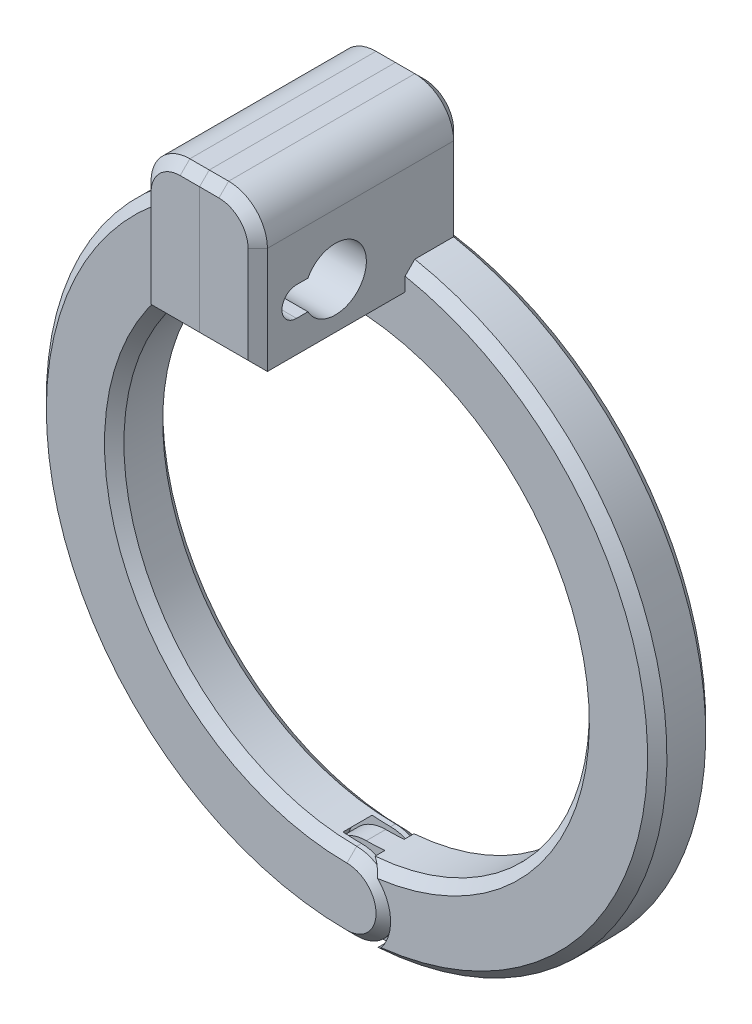
from build123d import *

# Parameters (mm, degrees)
AUFSATZ_LINEAR_AUSTRAGEN1_DEPTH             = 3
SKIZZE2_R                                   = 4.5
SCHNITT_LINEAR_AUSTRAGEN1_DEPTH             = 1.5
AUFSATZ_LINEAR_AUSTRAGEN2_REACH             = 73.617
SKIZZE3_R                                   = 2
AUFSATZ_LINEAR_AUSTRAGEN2_DIRECTION_2_REACH = 73.617
SKIZZE4_R                                   = 2.5
AUFSATZ_LINEAR_AUSTRAGEN4_DEPTH             = 3
SKIZZE5_R                                   = 4.5
SCHNITT_LINEAR_AUSTRAGEN2_DEPTH             = 2
AUFSATZ_LINEAR_START                        = -6
AUFSATZ_LINEAR_AUSTRAGEN5_DEPTH             = 6
AUFSATZ_LINEAR_AUSTRAGEN6_DEPTH             = 6
AUFSATZ_LINEAR_AUSTRAGEN7_DEPTH             = 15.2
AUFSATZ_LINEAR_START_2                      = 15.2
AUFSATZ_LINEAR_AUSTRAGEN9_DEPTH             = 15.2
SCHNITT_LINEAR_AUSTRAGEN3_DEPTH             = 6.5
FASE1_SIZE                                  = 1
FASE2_SIZE                                  = 1
FASE3_SIZE                                  = 1
FASE4_SIZE                                  = 1
FASE5_SIZE                                  = 1
FASE6_SIZE                                  = 1


# Some blends are built 0.0001 mm under size
with BuildPart() as part:
    # Skizze1 → Aufsatz-Linear austragen1 (new, symmetric)
    with BuildSketch(Plane.XY):
        with BuildLine():
            Line((0, -8), (0, 0))
            ThreePointArc((0, 0), (-32, -32), (0, -64))
            ThreePointArc((0, -64), (4, -60), (0, -56))
            ThreePointArc((0, -56), (-24, -32), (0, -8))
        make_face()
    extrude(amount=AUFSATZ_LINEAR_AUSTRAGEN1_DEPTH, both=True)

    # Skizze2 → Schnitt-Linear austragen1 (cut, symmetric)
    with BuildSketch(Plane.XY):
        with Locations((0, -60)):
            Circle(SKIZZE2_R)
    extrude(amount=SCHNITT_LINEAR_AUSTRAGEN1_DEPTH, both=True, mode=Mode.SUBTRACT)

    # Aufsatz-Linear austragen2: up to this face of the body (flat: up to its plane)
    aufsatz_linear_austragen2_end = Plane(part.part.faces().sort_by_distance((-0.306004635, -59.992467517, 1.5))[0])
    # Skizze3 → Aufsatz-Linear austragen2 (add, up to the picked face)
    with BuildSketch(Plane.XY, mode=Mode.PRIVATE) as aufsatz_linear_austragen2_sk1:
        with Locations((0, -60)):
            Circle(SKIZZE3_R)
    aufsatz_linear_austragen2_tool1 = split(extrude(aufsatz_linear_austragen2_sk1.sketch, amount=AUFSATZ_LINEAR_AUSTRAGEN2_REACH, mode=Mode.PRIVATE), bisect_by=aufsatz_linear_austragen2_end, keep=Keep.BOTH, mode=Mode.PRIVATE)
    add(aufsatz_linear_austragen2_tool1.solids().sort_by(Axis((0, -60, 0), (0, 0, 1)))[0])

    # Aufsatz-Linear austragen2 direction 2: up to this face of the body (flat: up to its plane)
    aufsatz_linear_austragen2_direction_2_end = Plane(part.part.faces().sort_by_distance((-0.306004635, -59.992467517, -1.5))[0])
    # Skizze3 → Aufsatz-Linear austragen2 direction 2 (add, up to the picked face)
    with BuildSketch(Plane.XY, mode=Mode.PRIVATE) as aufsatz_linear_austragen2_direction_2_sk1:
        with Locations((0, -60)):
            Circle(SKIZZE3_R)
    aufsatz_linear_austragen2_direction_2_tool1 = split(extrude(aufsatz_linear_austragen2_direction_2_sk1.sketch, amount=-AUFSATZ_LINEAR_AUSTRAGEN2_DIRECTION_2_REACH, mode=Mode.PRIVATE), bisect_by=aufsatz_linear_austragen2_direction_2_end, keep=Keep.BOTH, mode=Mode.PRIVATE)
    add(aufsatz_linear_austragen2_direction_2_tool1.solids().sort_by(Axis((0, -60, 0), (0, 0, -1)))[0])

    # Skizze7 → Aufsatz-Linear austragen6 (add)
    with BuildSketch(Plane(origin=(0, 0, -3), x_dir=(-1, 0, 0), z_dir=(0, 0, -1)).offset(AUFSATZ_LINEAR_START)):
        with BuildLine():
            Line((0, 0), (0, 12))
            Line((0, 12), (2, 12))
            ThreePointArc((2, 12), (4.828427125, 10.828427125), (6, 8))
            Line((6, 8), (6, -0.567532709))
            ThreePointArc((6, -0.567532709), (3.013390672, -0.142199124), (0, 0))
        make_face()
    extrude(amount=AUFSATZ_LINEAR_AUSTRAGEN6_DEPTH)

    # Skizze9 → Aufsatz-Linear austragen9 (add)
    with BuildSketch(Plane.XY.offset(3).offset(AUFSATZ_LINEAR_START_2)):
        with BuildLine():
            Line((-6, -3), (0, -3))
            Line((0, -3), (0, 12))
            Line((0, 12), (-2, 12))
            ThreePointArc((-2, 12), (-4.828427125, 10.828427125), (-6, 8))
            Line((-6, 8), (-6, -0.567532709))
            Line((-6, -0.567532709), (-6, -3))
        make_face()
    extrude(amount=-AUFSATZ_LINEAR_AUSTRAGEN9_DEPTH)


with BuildPart() as body_2:
    # Skizze4 → Aufsatz-Linear austragen4 (new, symmetric)
    with BuildSketch(Plane.XY):
        with BuildLine():
            Line((0, -8), (0, 0))
            ThreePointArc((0, 0), (32, -32), (0, -64))
            ThreePointArc((0, -64), (-4, -60), (0, -56))
            ThreePointArc((0, -56), (24, -32), (0, -8))
        make_face()
        with Locations((0, -60)):
            Circle(SKIZZE4_R, mode=Mode.SUBTRACT)
    extrude(amount=AUFSATZ_LINEAR_AUSTRAGEN4_DEPTH, both=True)

    # Skizze5 → Schnitt-Linear austragen2 (cut)
    with BuildSketch(Plane.XY.offset(3)):
        with Locations((0, -60)):
            Circle(SKIZZE5_R)
    schnitt_linear_austragen2 = extrude(amount=-SCHNITT_LINEAR_AUSTRAGEN2_DEPTH, mode=Mode.SUBTRACT)

    # Spiegeln1: Schnitt-Linear austragen2 across plane
    add(schnitt_linear_austragen2.mirror(Plane.XY), mode=Mode.SUBTRACT)

    # Skizze6 → Aufsatz-Linear austragen5 (add)
    with BuildSketch(Plane(origin=(0, 0, -3), x_dir=(-1, 0, 0), z_dir=(0, 0, -1)).offset(AUFSATZ_LINEAR_START)):
        with BuildLine():
            Line((0, 0), (0, 12))
            Line((0, 12), (-2, 12))
            ThreePointArc((-2, 12), (-4.828427125, 10.828427125), (-6, 8))
            Line((-6, 8), (-6, -0.567532709))
            ThreePointArc((-6, -0.567532709), (-3.013390672, -0.142199124), (0, 0))
        make_face()
    extrude(amount=AUFSATZ_LINEAR_AUSTRAGEN5_DEPTH)

    # Skizze8 → Aufsatz-Linear austragen7 (add)
    with BuildSketch(Plane.XY.offset(3)):
        with BuildLine():
            Line((0, -3), (6, -3))
            Line((6, -3), (6, 8))
            ThreePointArc((6, 8), (4.828427125, 10.828427125), (2, 12))
            Line((2, 12), (0, 12))
            Line((0, 12), (0, -3))
        make_face()
    extrude(amount=AUFSATZ_LINEAR_AUSTRAGEN7_DEPTH)


with BuildPart() as schnitt_linear_austragen3_tool:
    # Skizze10 → Schnitt-Linear austragen3 (new, symmetric)
    with BuildSketch(Plane(origin=(0, 0, 0), x_dir=(0, 0, -1), z_dir=(1, 0, 0))):
        with BuildLine():
            Line((-14.2, 0.25), (-13.026658805, 0.25))
            ThreePointArc((-13.026658805, 0.25), (-7, 1.75), (-13.026658805, 3.25))
            Line((-13.026658805, 3.25), (-14.2, 3.25))
            ThreePointArc((-14.2, 3.25), (-15.7, 1.75), (-14.2, 0.25))
        make_face()
    extrude(amount=SCHNITT_LINEAR_AUSTRAGEN3_DEPTH, both=True)


with BuildPart() as part_1:
    add(part.part)

    # Schnitt-Linear austragen3: cut by schnitt_linear_austragen3_tool
    add(schnitt_linear_austragen3_tool.part, mode=Mode.SUBTRACT)

    # Fase2
    # the kernel refuses this chamfer: 1 mm, written as the material it takes off along each edge
    with BuildSketch(Plane(origin=(0, -32, 3), x_dir=(0.10711985504033346, -0.9942461147302201, 0), z_dir=(0.9942461147302201, 0.10711985504033346, 0))) as fase2_piece_1:
        Polygon((24, FASE2_SIZE), (24 + FASE2_SIZE, 0), (24, 0), align=None)
    revolve(axis=Axis((0, -32, 3), (0, 0, -1)), revolution_arc=192.298628552, mode=Mode.SUBTRACT)
    with BuildSketch(Plane(origin=(0, -32, -3), x_dir=(0.10711985504033346, -0.9942461147302201, 0), z_dir=(0.9942461147302201, 0.10711985504033346, 0))) as fase2_piece_2:
        Polygon((24, -FASE2_SIZE), (24 + FASE2_SIZE, 0), (24, 0), align=None)
    revolve(axis=Axis((0, -32, -3), (0, 0, -1)), revolution_arc=192.298628552, mode=Mode.SUBTRACT)

    # Fase4
    fase4_edges = [part_1.edges().sort_by_distance(p)[0] for p in [
        (-31.857800876, -35.013390672, 3),
        (-31.857800876, -35.013390672, -3),
        (3.774917218, -61.322875656, 3),
        (-1, 12, -3),
        (-4.828427125, 10.828427125, -3),
        (3.774917218, -61.322875656, -3),
        (-6, 3.716233646, -3),
    ]]
    chamfer(fase4_edges, length=FASE4_SIZE - 0.0001)  # a hair under: the kernel refuses the full size

    # Fase6
    fase6_edges = [part_1.edges().sort_by_distance(p)[0] for p in [
        (-3, -3, 18.2),
        (-4.828427125, 10.828427125, 18.2),
        (-6, 2.5, 18.2),
        (-1, 12, 18.2),
    ]]
    chamfer(fase6_edges, length=FASE6_SIZE)


with BuildPart() as body_2_1:
    add(body_2.part)

    # Schnitt-Linear austragen3: cut by schnitt_linear_austragen3_tool
    add(schnitt_linear_austragen3_tool.part, mode=Mode.SUBTRACT)

    # Fase1
    fase1_edges = [body_2_1.edges().sort_by_distance(p)[0] for p in [
        (23.98101928, -31.045686485, 3),
        (23.98101928, -31.045686485, -3),
    ]]
    chamfer(fase1_edges, length=FASE1_SIZE)

    # Fase3
    fase3_edges = [body_2_1.edges().sort_by_distance(p)[0] for p in [
        (31.942674958, -33.914553878, 3),
        (31.942674958, -33.914553878, -3),
        (1, 12, -3),
        (4.828427125, 10.828427125, -3),
        (6, 3.716233646, -3),
    ]]
    chamfer(fase3_edges, length=FASE3_SIZE)

    # Fase5
    fase5_edges = [body_2_1.edges().sort_by_distance(p)[0] for p in [
        (3, -3, 18.2),
        (6, 2.5, 18.2),
        (4.828427125, 10.828427125, 18.2),
        (1, 12, 18.2),
    ]]
    chamfer(fase5_edges, length=FASE5_SIZE)


solid = Compound([part_1.part, body_2_1.part])
